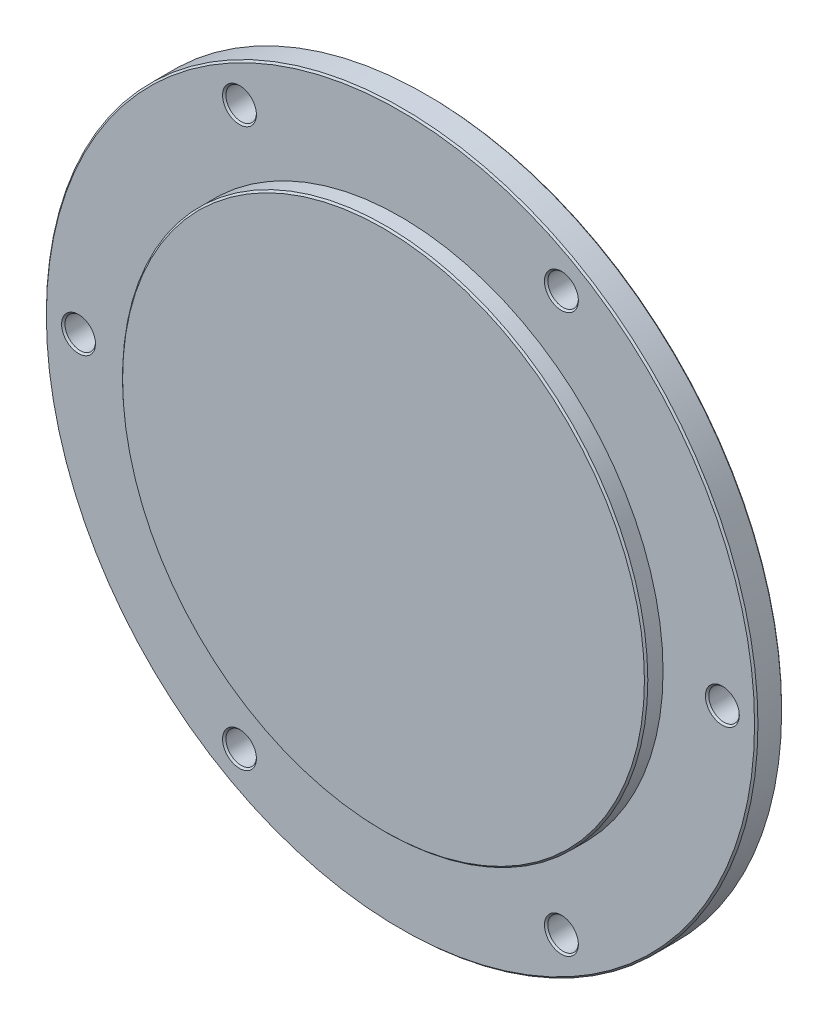
from build123d import *

# Parameters (mm, degrees)
HOLE1_D             = 9
HOLE2_D             = 9
SKETCH6_R           = 77.5
BOSS_EXTRUDE1_DEPTH = 5
CHAMFER1_SIZE       = 0.5


with BuildPart() as part:
    # Sketch1 → Revolve1 (revolve)
    with BuildSketch(Plane(origin=(0, 0, 0), x_dir=(1, 0, 0), z_dir=(0, 1, 0))):
        Polygon((105, 0), (0, 0), (0, -8), (104.5, -8), (105, -7.5), align=None)
    revolve(axis=Axis((0, 0, 0), (0, 0, 1)))

    # Hole1 (through all)
    with Locations(Plane.XY.offset(8)):
        with Locations((-47.5, -82.27241336), (-47.5, 82.27241336)):
            Hole(HOLE1_D / 2)

    # Hole2 (through all)
    with Locations(Plane(origin=(0, 0, 0), x_dir=(-1, 0, 0), z_dir=(0, 0, -1))):
        with Locations((-47.5, -82.27241336), (95, 0), (-47.5, 82.27241336), (-95, 0)):
            Hole(HOLE2_D / 2)

    # Sketch6 → Boss-Extrude1 (add)
    with BuildSketch(Plane.XY.offset(8)):
        Circle(SKETCH6_R)
    extrude(amount=BOSS_EXTRUDE1_DEPTH)

    # Chamfer1
    chamfer1_edges = [part.edges().sort_by_distance(p)[0] for p in [
        (43, -82.27241336, 8),
        (90.5, 0, 8),
        (-99.5, 0, 8),
        (-43, -82.27241336, 0),
        (43, -82.27241336, 0),
        (-99.5, 0, 0),
        (-43, -82.27241336, 8),
        (-43, 82.27241336, 0),
        (43, 82.27241336, 8),
        (43, 82.27241336, 0),
        (-105, 0, 0),
        (90.5, 0, 0),
        (-43, 82.27241336, 8),
        (-77.5, 0, 13),
    ]]
    chamfer(chamfer1_edges, length=CHAMFER1_SIZE)


solid = part.part
